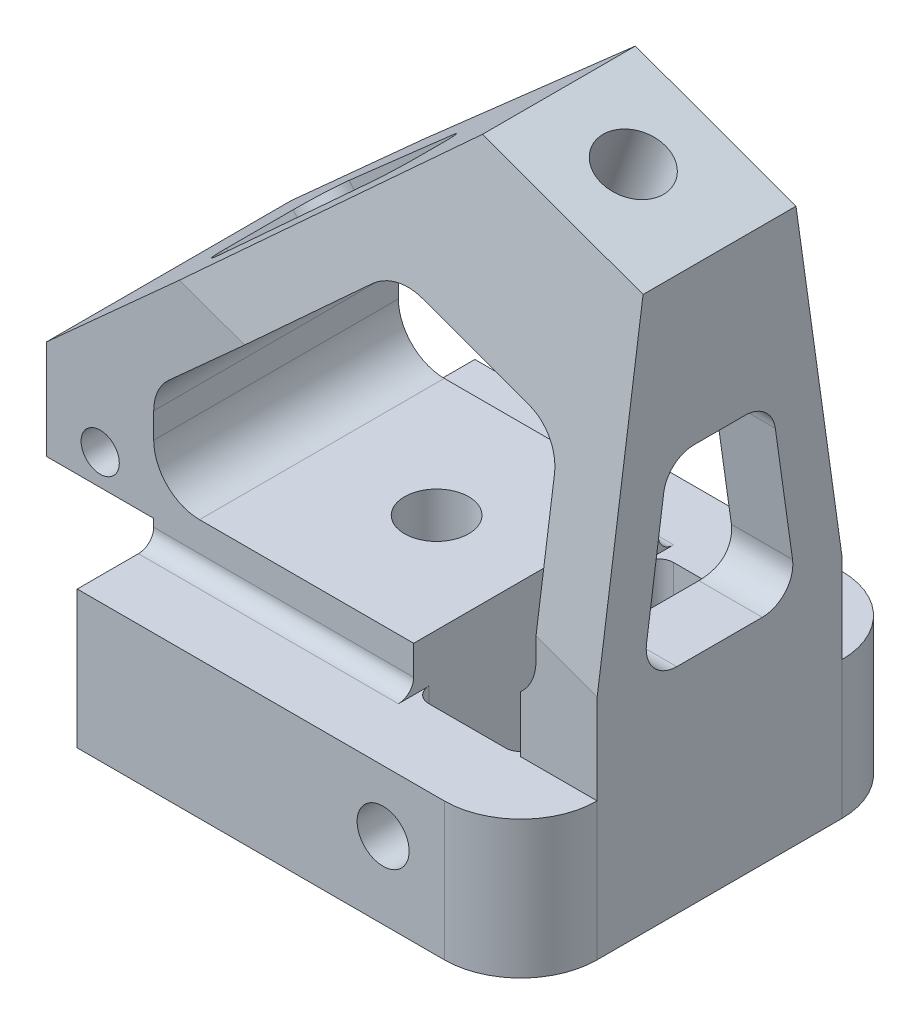
from build123d import *

# Parameters (mm, degrees)
BOSS_EXTRUDE1_DEPTH       = 13
SKETCH2_W                 = 26
SKETCH2_H                 = 9
CUT_EXTRUDE1_DEPTH        = 7
SKETCH3_W                 = 5.460158558
SKETCH3_H                 = 35.727642342
SKETCH3_W_2               = 6.990786849
SKETCH3_H_2               = 37.804269356
CUT_EXTRUDE2_DEPTH        = 56.362442143
M3X0_5_TAPPED_HOLE2_D     = 2.5
M3X0_5_TAPPED_HOLE2_DEPTH = 15
M3X0_5_TAPPED_HOLE2_TIP   = 0.751075774
M3X0_5_TAPPED_HOLE1_D     = 2.5
M3_CLEARANCE_HOLE1_D      = 3.4
CUT_EXTRUDE3_DEPTH        = 58.766772456
FILLET2_R                 = 3
CHAMFER1_SIZE             = 20
CHAMFER1_SIZE_2           = 3
CUT_EXTRUDE4_REACH        = 57.362
FILLET3_R                 = 2
CUT_EXTRUDE5_REACH        = 57.527
FILLET4_R                 = 2
M5X0_8_TAPPED_HOLE1_D     = 4.2
M5X0_8_TAPPED_HOLE1_DEPTH = 11.927025935
FILLET6_R                 = 5
CUT_EXTRUDE6_REACH        = 57.362
SKETCH19_W                = 7
SKETCH19_H                = 16
FILLET7_R                 = 1
CHAMFER2_SIZE             = 1.5
FILLET8_R                 = 0.5
FILLET9_R                 = 1


with BuildPart() as part:
    # Sketch1 → Boss-Extrude1 (new, symmetric)
    with BuildSketch(Plane.XY):
        Polygon((0, 0), (36, 0), (36, 36.17831254), (25.5, 40), (0, 17), align=None)
    extrude(amount=BOSS_EXTRUDE1_DEPTH, both=True)

    # Sketch2 → Cut-Extrude1 (cut)
    with BuildSketch(Plane.ZY):
        with Locations((0, 4.5)):
            Rectangle(SKETCH2_W, SKETCH2_H)
    extrude(amount=-CUT_EXTRUDE1_DEPTH, mode=Mode.SUBTRACT)

    # Sketch3 → Cut-Extrude2 (cut, through all)
    with BuildSketch(Plane.ZY):
        with Locations((10.730079279, 26.863821171)):
            Rectangle(SKETCH3_W, SKETCH3_H)
        with Locations((-11.495393425, 27.902134678)):
            Rectangle(SKETCH3_W_2, SKETCH3_H_2)
    extrude(amount=-CUT_EXTRUDE2_DEPTH, mode=Mode.SUBTRACT)

    # M3x0.5 Tapped Hole2
    with Locations(Plane(origin=(7, 5, -9.5), x_dir=(0, -1, 0), z_dir=(-1, 0, 0))):
        with Locations((0, 0), (0, 19)):
            Hole(M3X0_5_TAPPED_HOLE2_D / 2, depth=M3X0_5_TAPPED_HOLE2_DEPTH)
            with Locations((0, 0, -(M3X0_5_TAPPED_HOLE2_DEPTH + M3X0_5_TAPPED_HOLE2_TIP / 2))):  # 118° drill point
                Cone(0, M3X0_5_TAPPED_HOLE2_D / 2, M3X0_5_TAPPED_HOLE2_TIP, mode=Mode.SUBTRACT)

    # M3x0.5 Tapped Hole1 (through all)
    with Locations(Plane(origin=(3.5, 12.5, 8), x_dir=(1, 0, 0), z_dir=(0, 0, 1))):
        with Locations((0, 0)):
            Hole(M3X0_5_TAPPED_HOLE1_D / 2)

    # M3 Clearance Hole1 (through all)
    with Locations(Plane.XY.offset(13)):
        with Locations((27, 5)):
            Hole(M3_CLEARANCE_HOLE1_D / 2)

    # Sketch13 → Cut-Extrude3 (cut, through all)
    with BuildSketch(Plane.XY.offset(8)):
        Polygon((32, 18.871173631), (32, 26.992415753), (21.34884319, 30.869119792), (7, 17.927025935), (7, 11.927025935), (32, 11.927025935), align=None)
    extrude(amount=-CUT_EXTRUDE3_DEPTH, mode=Mode.SUBTRACT)

    # Fillet2
    fillet2_edges = [part.edges().sort_by_distance(p)[0] for p in [
        (7, 11.927025935, 0),
        (7, 17.927025935, 0),
        (21.34884319, 30.869119792, 0),
        (32, 26.992415753, 0),
        (32, 11.927025935, 0),
    ]]
    fillet(fillet2_edges, radius=FILLET2_R)

    # Chamfer1
    # the kernel refuses this chamfer: 20, 3 mm, written as the material it takes off along each edge
    with BuildSketch(Plane(origin=(84.844019059, 18.400543481, 8), x_dir=(-0.3420145720677014, -0.939677313880462, 0.005707737883485923), z_dir=(-0.9396926207859104, 0.3420201433256634, 0))) as chamfer1_piece_1:
        Polygon((CHAMFER1_SIZE * 0.999983710731, -CHAMFER1_SIZE * 0.00570773788349), (-CHAMFER1_SIZE_2 * 0.00570773788349, -CHAMFER1_SIZE_2 * 0.999983710731), (0, 0), align=None)
    extrude(amount=115.131305413, mode=Mode.SUBTRACT)
    with BuildSketch(Plane(origin=(84.844019059, 18.400543481, -8), x_dir=(0.08410022637244834, 0.23106347292932808, 0.9692970769593502), z_dir=(-0.9396926207859104, 0.3420201433256634, 0))) as chamfer1_piece_2:
        Polygon((CHAMFER1_SIZE_2 * 0.969297076959, -CHAMFER1_SIZE_2 * 0.245892611922), (-CHAMFER1_SIZE * 0.245892611922, -CHAMFER1_SIZE * 0.969297076959), (0, 0), align=None)
    extrude(amount=115.131305413, mode=Mode.SUBTRACT)

    # Sketch14 → Cut-Extrude4 (cut, up to next)
    with BuildSketch(Plane(origin=(36, 0, 0), x_dir=(0, 0, -1), z_dir=(1, 0, 0)), mode=Mode.PRIVATE) as cut_extrude4_sk1:
        Polygon((-3.405017352, 26), (3.405017352, 26), (5.096464069, 14), (-5.096464069, 14), align=None)
    cut_extrude4_tool1 = extrude(cut_extrude4_sk1.sketch, amount=-CUT_EXTRUDE4_REACH, mode=Mode.PRIVATE) & part.part
    add(cut_extrude4_tool1.solids().sort_by_distance((36, 19.602082, 0))[0], mode=Mode.SUBTRACT)

    # Fillet3
    fillet3_edges = [part.edges().sort_by_distance(p)[0] for p in [
        (33.926588844, 14, -5.096464069),
        (33.926588844, 14, 5.096464069),
        (33.893904368, 26, -3.405017352),
        (33.893904368, 26, 3.405017352),
    ]]
    fillet(fillet3_edges, radius=FILLET3_R)

    # Sketch16 → Cut-Extrude5 (cut, up to next)
    with BuildSketch(Plane(origin=(-8.45495018, 9.373966504, 0), x_dir=(0.7425697235686507, 0.669768770277607, 0), z_dir=(-0.669768770277607, 0.7425697235686507, 0)), mode=Mode.PRIVATE) as cut_extrude5_sk1:
        Polygon((19.386069095, 4.455184815), (19.386069095, -4.455184815), (34.386069095, -2.467646022), (34.386069095, 2.467646022), align=None)
    cut_extrude5_tool1 = extrude(cut_extrude5_sk1.sketch, amount=-CUT_EXTRUDE5_REACH, mode=Mode.PRIVATE) & part.part
    add(cut_extrude5_tool1.solids().sort_by_distance((10.976853, 26.900691, 0))[0], mode=Mode.SUBTRACT)

    # Fillet4
    fillet4_edges = [part.edges().sort_by_distance(p)[0] for p in [
        (7.280095329, 20.873010715, -4.455184815),
        (18.418641183, 30.919542269, -2.467646022),
        (18.418641183, 30.919542269, 2.467646022),
        (7.280095329, 20.873010715, 4.455184815),
    ]]
    fillet(fillet4_edges, radius=FILLET4_R)

    # M5x0.8 Tapped Hole1
    with Locations(Plane(origin=(0, 0, 0), x_dir=(-1, 0, 0), z_dir=(0, -1, 0))):
        with Locations((-17.5, 0)):
            Hole(M5X0_8_TAPPED_HOLE1_D / 2, depth=M5X0_8_TAPPED_HOLE1_DEPTH)

    # Fillet6
    fillet6_edges = [part.edges().sort_by_distance(p)[0] for p in [
        (36, 4.5, 13),
        (36, 4.5, -13),
    ]]
    fillet(fillet6_edges, radius=FILLET6_R)

    # Sketch19 → Cut-Extrude6 (cut, up to next)
    with BuildSketch(Plane.XZ, mode=Mode.PRIVATE) as cut_extrude6_sk1:
        with Locations((27.5, 0)):
            Rectangle(SKETCH19_W, SKETCH19_H)
    cut_extrude6_tool1 = extrude(cut_extrude6_sk1.sketch, amount=-CUT_EXTRUDE6_REACH, mode=Mode.PRIVATE) & part.part
    add(cut_extrude6_tool1.solids().sort_by_distance((27.5, 0, 0))[0], mode=Mode.SUBTRACT)

    # Fillet7
    fillet7_edges = [part.edges().sort_by_distance(p)[0] for p in [
        (24, 4.5, 8),
        (31, 4.5, -8),
        (24, 4.5, -8),
        (31, 4.5, 8),
    ]]
    fillet(fillet7_edges, radius=FILLET7_R)

    # Sketch21 → M5x0.8 Tapped Hole2 (revolve, cut)
    with BuildSketch(Plane(origin=(30.361844275, 38.2304334, 0), x_dir=(-0.9396926207859102, 0.3420201433256637, 0), z_dir=(0, 0, 1))):
        Polygon((0, 0), (0, 10), (2.675, 10), (2.1, 9.425), (2.1, 0), align=None)
    revolve(axis=Axis((32.533672185, 44.197481542, 0), (-0.3420201433256637, -0.9396926207859103, 0)), mode=Mode.SUBTRACT)

    # Chamfer2
    chamfer2_edges = [part.edges().sort_by_distance(p)[0] for p in [
        (3.5, 9, 8),
        (3.5, 9, -8),
    ]]
    chamfer(chamfer2_edges, length=CHAMFER2_SIZE)

    # Fillet8
    fillet8_edges = [part.edges().sort_by_distance(p)[0] for p in [
        (7, 9, 0),
    ]]
    fillet(fillet8_edges, radius=FILLET8_R)

    # Fillet9
    fillet9_edges = [part.edges().sort_by_distance(p)[0] for p in [
        (15.5, 9, 8),
        (15.5, 9, -8),
    ]]
    fillet(fillet9_edges, radius=FILLET9_R)


solid = part.part
